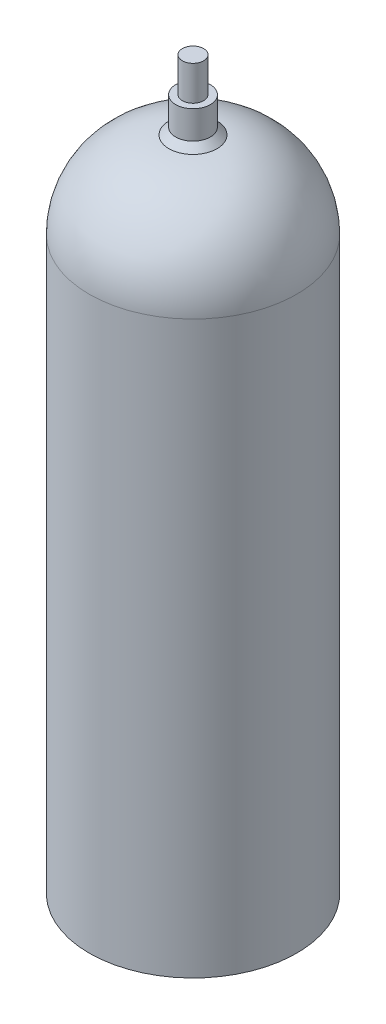
from build123d import *

# Parameters (mm, degrees)
CHAMFER2_SIZE      = 2.38
CUT_EXTRUDE1_START = -12.7
SKETCH2_R          = 6.35
SKETCH2_R_2        = 3.902029093
CUT_EXTRUDE1_DEPTH = 12.7


with BuildPart() as part:
    # Sketch1 → Revolve1 (revolve)
    with BuildSketch(Plane.XY, mode=Mode.PRIVATE) as revolve1_sk:
        with BuildLine():
            Line((0, 248.389026298), (6.35, 248.389026298))
            Line((6.35, 248.389026298), (6.35, 222.989026298))
            ThreePointArc((6.35, 222.989026298), (28.800640303, 213.6896666), (38.1, 191.239026298))
            Line((38.1, 191.239026298), (38.1, -18.310973702))
            Line((38.1, -18.310973702), (0, -18.310973702))
            Line((0, -18.310973702), (0, 248.389026298))
        make_face()
    revolve(revolve1_sk.sketch.rotate(Axis((0, 337.108439078, 0), (0, -1, 0)), 90), axis=Axis((0, 337.108439078, 0), (0, -1, 0)))

    # Chamfer2
    # the kernel refuses this chamfer: 2.38 mm, written as the material it adds along each edge
    with BuildSketch(Plane(origin=(0, 222.989026298, 0), x_dir=(0, 0, 1), z_dir=(1, 0, 0))) as chamfer2_piece_1:
        with BuildLine():
            Line((6.35, -CHAMFER2_SIZE), (8.826750448, 0.096750448))
            ThreePointArc((8.826750448, 0.096750448), (7.624301016, 0.025582639), (6.35, 0))
            Line((6.35, 0), (6.35, -CHAMFER2_SIZE))
        make_face()
    revolve(axis=Axis((0, 222.989026298, 0), (0, -1, 0)))

    # Sketch2 → Cut-Extrude1 (cut)
    with BuildSketch(Plane(origin=(0, 248.389026298, 0), x_dir=(1, 0, 0), z_dir=(0, 1, 0)).offset(CUT_EXTRUDE1_START)):
        with Locations(Location((0, 0, 0), (0, 0, 270))):
            Circle(SKETCH2_R)
        with Locations(Location((0, 0, 0), (0, 0, 270))):
            Circle(SKETCH2_R_2, mode=Mode.SUBTRACT)
    extrude(amount=CUT_EXTRUDE1_DEPTH, mode=Mode.SUBTRACT)


solid = part.part
